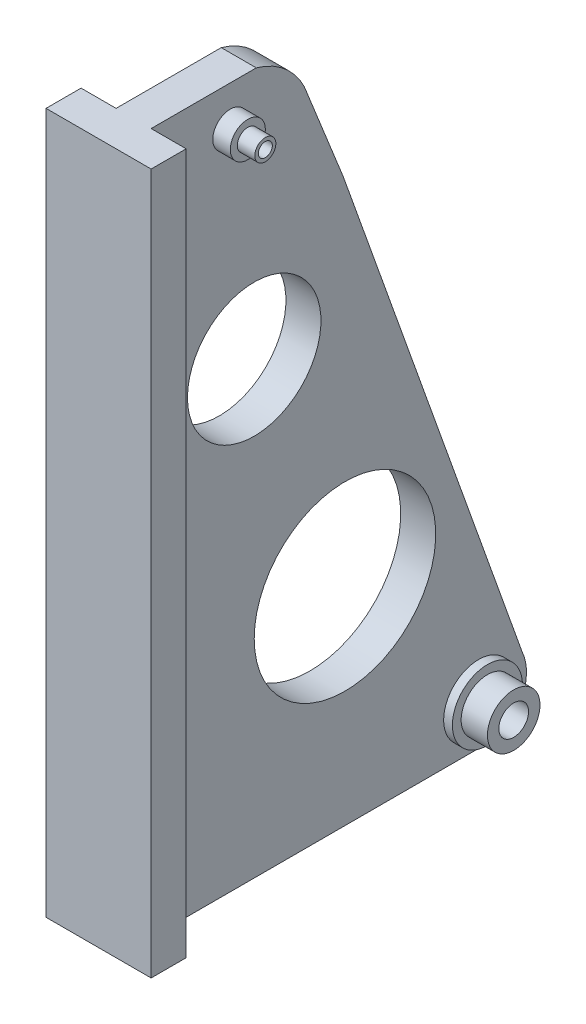
from build123d import *

# Parameters (mm, degrees)
RESSALTO_EXTRUS_O1_DEPTH   = 30
ESBO_O7_W                  = 124.831233659
ESBO_O7_H                  = 205.409079033
CORTE_EXTRUS_O1_DEPTH      = 26
ESBO_O9_W                  = 108.1037386
ESBO_O9_H                  = 206.486977543
CORTE_EXTRUS_O2_DEPTH      = 72
ESBO_O10_R                 = 3
ESBO_O10_R_2               = 2
RESSALTO_EXTRUS_O2_DEPTH   = 15
ESBO_O10_4_R               = 5
RESSALTO_EXTRUS_O3_DEPTH   = 10
ESBO_O10_5_R               = 2
CORTE_EXTRUS_O3_DEPTH      = 7.5
ESBO_O10_6_R               = 7.5
RESSALTO_EXTRUS_O4_DEPTH   = 15
ESBO_O10_7_R               = 10
RESSALTO_EXTRUS_O5_DEPTH   = 7.5
ESBO_O10_8_R               = 4.25
CORTE_EXTRUS_O4_DEPTH      = 10
CORTE_EXTRUS_O7_DEPTH      = 29
CORTE_EXTRUS_O7_DEPTH_BACK = 40
ESBO_O11_R                 = 25.910960488
ESBO_O11_R_2               = 19.055112842
ESBO_O10_9_R               = 4.25
CORTE_EXTRUS_O8_DEPTH      = 23


with BuildPart() as part:
    # Esboço1 → Ressalto-extrusão1 (new body)
    with BuildSketch(Plane(origin=(0, 0, 0), x_dir=(0, 0, -1), z_dir=(1, 0, 0))):
        with BuildLine():
            Line((0, 0), (0, 200))
            Line((0, 200), (40.020408359, 200))
            ThreePointArc((40.020408359, 200), (48.108078735, 195.725277713), (53.718695877, 188.5))
            Line((53.718695877, 188.5), (64.817635807, 160.769350553))
            Line((64.817635807, 160.769350553), (115.921293578, 17.653015861))
            ThreePointArc((115.921293578, 17.653015861), (116.438632656, 7.659898466), (110, 0))
            Line((110, 0), (0, 0))
        make_face()
    extrude(amount=RESSALTO_EXTRUS_O1_DEPTH)

    # Esboço7 → Corte-extrusão1 (cut)
    with BuildSketch(Plane(origin=(20, 0, 0), x_dir=(0, 0, -1), z_dir=(1, 0, 0))):
        with Locations((72.41561683, 101.939412441)):
            Rectangle(ESBO_O7_W, ESBO_O7_H)
    extrude(amount=CORTE_EXTRUS_O1_DEPTH, mode=Mode.SUBTRACT)

    # Esboço9 → Corte-extrusão2 (cut)
    with BuildSketch(Plane.ZY.offset(-10)):
        with Locations((-64.0518693, 99.930966914)):
            Rectangle(ESBO_O9_W, ESBO_O9_H)
    extrude(amount=CORTE_EXTRUS_O2_DEPTH, mode=Mode.SUBTRACT)

    # Esboço10 → Ressalto-extrusão2 (add)
    with BuildSketch(Plane(origin=(15, 0, 0), x_dir=(0, 0, -1), z_dir=(1, 0, 0))):
        with Locations((32.599588138, 188.5)):
            Circle(ESBO_O10_R)
        with Locations((32.599588138, 188.5)):
            Circle(ESBO_O10_R_2, mode=Mode.SUBTRACT)
    extrude(amount=RESSALTO_EXTRUS_O2_DEPTH)

    # Esboço10<4> → Ressalto-extrusão3 (add)
    with BuildSketch(Plane(origin=(15, 0, 0), x_dir=(0, 0, -1), z_dir=(1, 0, 0))):
        with Locations((32.599588138, 188.5)):
            Circle(ESBO_O10_4_R)
    extrude(amount=RESSALTO_EXTRUS_O3_DEPTH)

    # Esboço10<5> → Corte-extrusão3 (cut, symmetric)
    with BuildSketch(Plane(origin=(15, 0, 0), x_dir=(0, 0, -1), z_dir=(1, 0, 0))):
        with Locations((32.599588138, 188.5)):
            Circle(ESBO_O10_5_R)
    extrude(amount=CORTE_EXTRUS_O3_DEPTH, both=True, mode=Mode.SUBTRACT)

    # Esboço10<6> → Ressalto-extrusão4 (add)
    with BuildSketch(Plane(origin=(15, 0, 0), x_dir=(0, 0, -1), z_dir=(1, 0, 0))):
        with Locations((103.499588138, 12)):
            Circle(ESBO_O10_6_R)
    extrude(amount=RESSALTO_EXTRUS_O4_DEPTH)

    # Esboço10<7> → Ressalto-extrusão5 (add, symmetric)
    with BuildSketch(Plane(origin=(15, 0, 0), x_dir=(0, 0, -1), z_dir=(1, 0, 0))):
        with Locations((103.499588138, 12)):
            Circle(ESBO_O10_7_R)
    extrude(amount=RESSALTO_EXTRUS_O5_DEPTH, both=True)

    # Esboço10<8> → Corte-extrusão4 (cut, symmetric)
    with BuildSketch(Plane(origin=(15, 0, 0), x_dir=(0, 0, -1), z_dir=(1, 0, 0))):
        with Locations((103.499588138, 12)):
            Circle(ESBO_O10_8_R)
    extrude(amount=CORTE_EXTRUS_O4_DEPTH, both=True, mode=Mode.SUBTRACT)

    # Esboço11 → Corte-extrusão7 (cut, two sides: drawn at the far end of the back side and taken through both)
    with BuildSketch(Plane(origin=(15, 0, 0), x_dir=(0, 0, -1), z_dir=(1, 0, 0)).offset(-CORTE_EXTRUS_O7_DEPTH_BACK)):
        with Locations((65.337848258, 59.141484688)):
            Circle(ESBO_O11_R)
        with Locations((39.426887771, 128.280550769)):
            Circle(ESBO_O11_R_2)
    extrude(amount=CORTE_EXTRUS_O7_DEPTH + CORTE_EXTRUS_O7_DEPTH_BACK, mode=Mode.SUBTRACT)

    # Esboço10<9> → Corte-extrusão8 (cut, symmetric)
    with BuildSketch(Plane(origin=(15, 0, 0), x_dir=(0, 0, -1), z_dir=(1, 0, 0))):
        with Locations((103.499588138, 12)):
            Circle(ESBO_O10_9_R)
    extrude(amount=CORTE_EXTRUS_O8_DEPTH, both=True, mode=Mode.SUBTRACT)


solid = part.part
